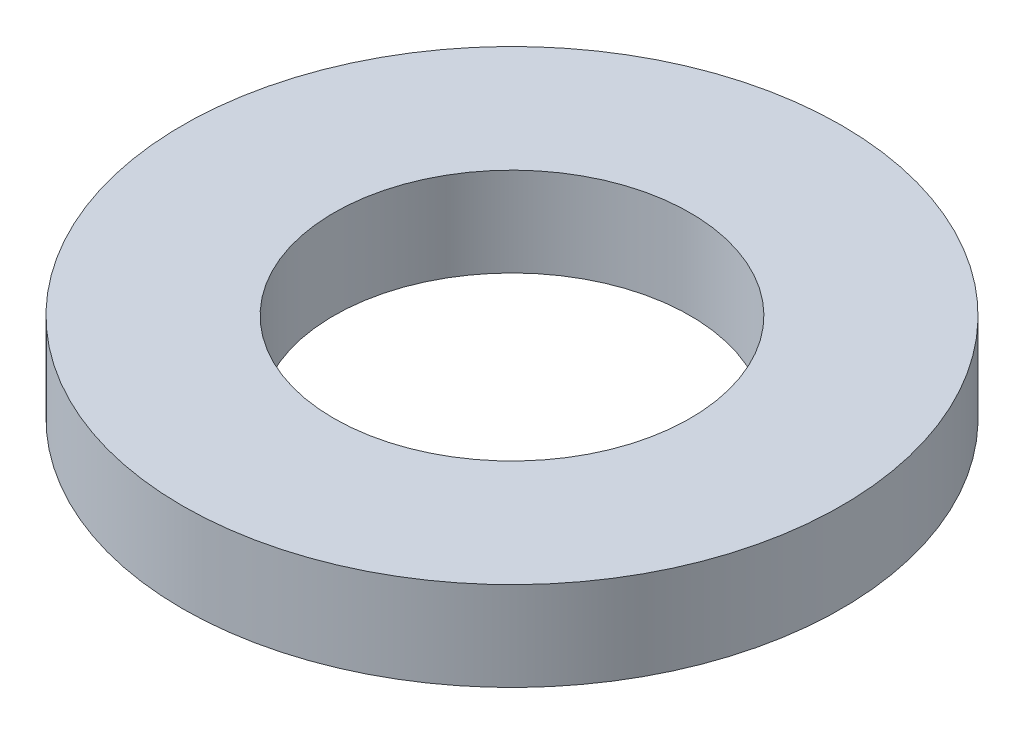
from build123d import *

# Parameters (mm, degrees)
SKETCH1_R           = 92.5
BOSS_EXTRUDE1_DEPTH = 25
SKETCH2_R           = 50
CUT_EXTRUDE1_DEPTH  = 134.182206019


with BuildPart() as part:
    # Sketch1 → Boss-Extrude1 (new body)
    with BuildSketch(Plane(origin=(0, 0, 0), x_dir=(1, 0, 0), z_dir=(0, 1, 0))):
        Circle(SKETCH1_R)
    extrude(amount=BOSS_EXTRUDE1_DEPTH)

    # Sketch2 → Cut-Extrude1 (cut, through all)
    with BuildSketch(Plane(origin=(0, 0, 0), x_dir=(1, 0, 0), z_dir=(0, 1, 0))):
        Circle(SKETCH2_R)
    extrude(amount=CUT_EXTRUDE1_DEPTH, mode=Mode.SUBTRACT)


solid = part.part
